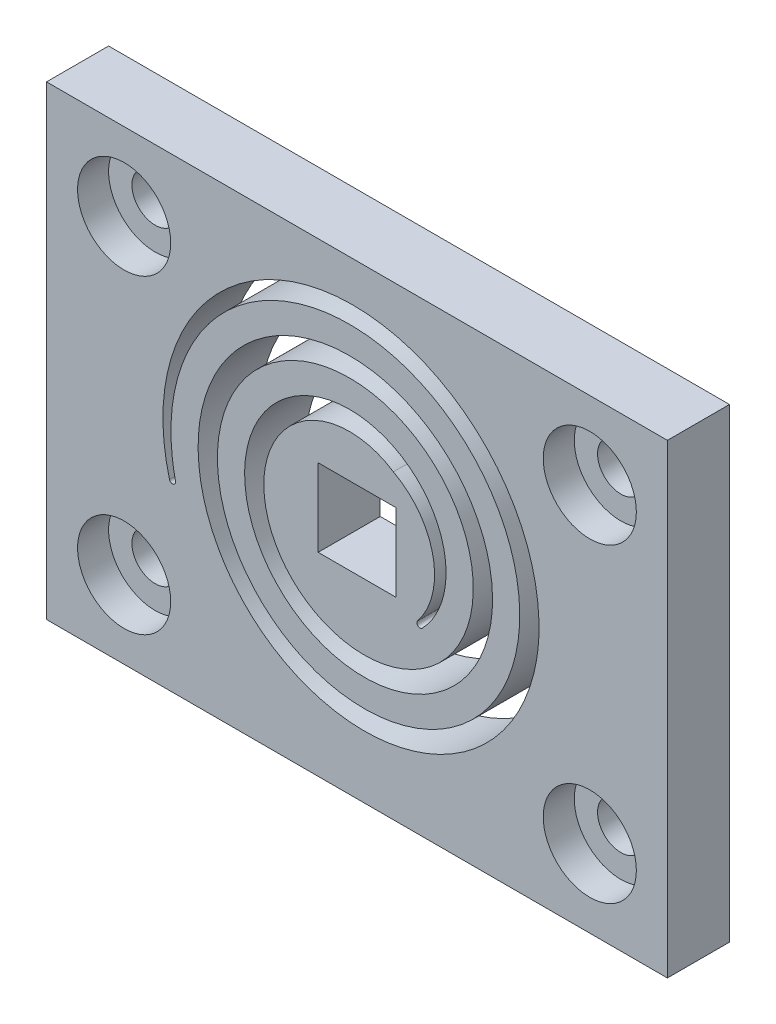
from build123d import *

# Parameters (mm, degrees)
SKIZZE1_W                       = 40
SKIZZE1_H                       = 30
AUFSATZ_LINEAR_AUSTRAGEN1_DEPTH = 4
SCHNITT_LINEAR_AUSTRAGEN3_REACH = 52.16
SKIZZE5_R                       = 12.5
SKIZZE5_R_2                     = 5
SKIZZE8_R                       = 3
SKIZZE8_R_2                     = 1.5
SCHNITT_LINEAR_AUSTRAGEN6_DEPTH = 2
SKIZZE8_3_R                     = 1.5
SCHNITT_LINEAR_AUSTRAGEN7_DEPTH = 4
AUSTRAGUNG3_DEPTH               = 4
VERRUNDUNG2_R                   = 0.2
SCHNITT_LINEAR_AUSTRAGEN8_REACH = 52.16
SKIZZE17_W                      = 5
SKIZZE17_H                      = 5
VERRUNDUNG3_DEPTH               = 4


with BuildPart() as part:
    # Skizze1 → Aufsatz-Linear austragen1 (new body)
    with BuildSketch(Plane.XY):
        with Locations((20, 15)):
            Rectangle(SKIZZE1_W, SKIZZE1_H)
    extrude(amount=AUFSATZ_LINEAR_AUSTRAGEN1_DEPTH)

    # Skizze5 → Schnitt-Linear austragen3 (cut, up to next)
    with BuildSketch(Plane.XY.offset(4), mode=Mode.PRIVATE) as schnitt_linear_austragen3_sk1:
        with Locations((20, 15)):
            Circle(SKIZZE5_R)
        with Locations((20, 15)):
            Circle(SKIZZE5_R_2, mode=Mode.SUBTRACT)
    schnitt_linear_austragen3_tool1 = extrude(schnitt_linear_austragen3_sk1.sketch, amount=-SCHNITT_LINEAR_AUSTRAGEN3_REACH, mode=Mode.PRIVATE) & part.part
    add(schnitt_linear_austragen3_tool1.solids().sort_by_distance((7.853553, 15, 4))[0], mode=Mode.SUBTRACT)


with BuildPart() as schnitt_linear_austragen3_piece_1:
    # of the separate pieces the step leaves, piece 1, a body of its own (schnitt_linear_austragen3_pieces)
    add(part.part.solids().sort_by_distance((0, 0, 0))[0])

    # Skizze8 → Schnitt-Linear austragen6 (cut)
    # profile 1 of 4: a face of its own
    with BuildSketch(Plane.XY.offset(4)):
        with Locations((5, 25)):
            Circle(SKIZZE8_R)
        with Locations((5, 25)):
            Circle(SKIZZE8_R_2, mode=Mode.SUBTRACT)
    # profile 2 of 4: a face of its own
    with BuildSketch(Plane.XY.offset(4)):
        with Locations((5, 5)):
            Circle(SKIZZE8_R)
        with Locations((5, 5)):
            Circle(SKIZZE8_R_2, mode=Mode.SUBTRACT)
    # profile 3 of 4: a face of its own
    with BuildSketch(Plane.XY.offset(4)):
        with Locations((35, 5)):
            Circle(SKIZZE8_R)
        with Locations((35, 5)):
            Circle(SKIZZE8_R_2, mode=Mode.SUBTRACT)
    # profile 4 of 4: a face of its own
    with BuildSketch(Plane.XY.offset(4)):
        with Locations((35, 25)):
            Circle(SKIZZE8_R)
        with Locations((35, 25)):
            Circle(SKIZZE8_R_2, mode=Mode.SUBTRACT)
    extrude(amount=-SCHNITT_LINEAR_AUSTRAGEN6_DEPTH, mode=Mode.SUBTRACT)

    # Skizze8<3> → Schnitt-Linear austragen7 (cut)
    with BuildSketch(Plane.XY.offset(4)):
        with Locations((5, 25)):
            Circle(SKIZZE8_3_R)
        with Locations((5, 5)):
            Circle(SKIZZE8_3_R)
        with Locations((35, 5)):
            Circle(SKIZZE8_3_R)
        with Locations((35, 25)):
            Circle(SKIZZE8_3_R)
    extrude(amount=-SCHNITT_LINEAR_AUSTRAGEN7_DEPTH, mode=Mode.SUBTRACT)



with BuildPart() as schnitt_linear_austragen3_piece_2:
    # of the separate pieces the step leaves, piece 2, a body of its own (schnitt_linear_austragen3_pieces)
    add(part.part.solids().sort_by_distance((25, 15, 0))[0])


with BuildPart() as schnitt_linear_austragen3_piece_1_1:
    add(schnitt_linear_austragen3_piece_1.part)

    add(schnitt_linear_austragen3_piece_2.part)  # Austragung3 merges Schnitt-Linear austragen3 piece 2
    # Austragung3: read off the stored shape, not the designer's step
    # Austragung3 outline → Austragung3 (add)
    with BuildSketch(Plane.XY):
        with BuildLine():
            ThreePointArc((20.290475643, 10.008444741), (15.115655057, 16.069193376), (22.349306116, 19.413701482))
            add(Edge.make_bspline(
                [(22.349306116, 19.413701482), (22.216520244, 19.501407181), (21.830098608, 19.730975714), (21.410473966, 19.909685311), (20.849463367, 20.09234631), (20.26798133, 20.22741462), (19.662909626, 20.261338126), (19.054675024, 20.242012194), (18.443396861, 20.16938524), (17.844897507, 19.990546946), (17.262077074, 19.759067332), (16.695069225, 19.474939888), (16.17775592, 19.092561984), (15.694099647, 18.664785764), (15.244231517, 18.191653197), (14.876884319, 17.640979395), (14.55799013, 17.058236973), (14.287660114, 16.443513543), (14.124228248, 15.782792022), (14.018828569, 15.108068598), (13.971536651, 14.41946753), (14.043557931, 13.723859806), (14.176496085, 13.035035891), (14.370379354, 12.353142455), (14.681850271, 11.70618519), (15.049721945, 11.0870547), (15.473969144, 10.495902206), (15.999433405, 9.979489855), (16.569572202, 9.509590232), (17.184307346, 9.086339803), (17.870554961, 8.770427378), (18.583645659, 8.514913194), (19.323455692, 8.319900657), (20.094783417, 8.253213859), (20.870938607, 8.254053472), (21.651765577, 8.322474955), (22.418296428, 8.525442788), (23.165986915, 8.795105072), (23.894667759, 9.131459914), (24.562819682, 9.592355628), (25.189663105, 10.11088872), (25.775036065, 10.686997461), (26.258921149, 11.361910526), (26.683057999, 12.077924883), (27.047312871, 12.83492402), (27.279681586, 13.651729834), (27.440342123, 14.487328381), (27.529207166, 15.341560607), (27.470553265, 16.207560016), (27.336464087, 17.066765156), (27.126911853, 17.918992596), (26.771528764, 18.731421048), (26.346024578, 19.511193166), (25.850437167, 20.25812316), (25.228550181, 20.91633968), (24.550623338, 21.518923067), (23.816758239, 22.065708396), (22.992312182, 22.483619442), (22.13330921, 22.828737762), (21.239904636, 23.100940842), (20.304111254, 23.218130172), (19.360315889, 23.253516566), (18.408710391, 23.207036992), (17.469990119, 22.997176352), (16.551851761, 22.706073685), (15.654501276, 22.333735739), (14.825924299, 21.809135934), (14.045134263, 21.213728235), (13.312326169, 20.547591137), (12.698007105, 19.759189492), (12.153934536, 18.919391522), (11.680267853, 18.028340548), (11.362349452, 17.060959576), (11.129481509, 16.068544446), (10.98176666, 15.051288056), (11.009612595, 14.014577756), (11.127577108, 12.983196773), (11.335691213, 11.9573656), (11.71869185, 10.973387825), (12.186176946, 10.025561643), (12.738099372, 9.114108939), (13.443097709, 8.30296798), (14.216548249, 7.555537221), (15.058328653, 6.872012613), (16.01213976, 6.337223285), (17.009553157, 5.886985692), (18.05038363, 5.521444777), (19.147271612, 5.336817384), (20.256800736, 5.248112602), (21.378743449, 5.255404718), (22.492107947, 5.455098355), (23.584580427, 5.750919966), (24.65591746, 6.142861575), (25.652902441, 6.715922437), (26.596857924, 7.373755824), (27.487553909, 8.116269631), (28.244893433, 9.006464309), (28.922388468, 9.959509097), (29.519851075, 10.975236177), (29.939063026, 12.086368531), (30.260345096, 13.230167389), (30.483575815, 14.40640722), (30.503635746, 15.61264428), (30.418867949, 16.816481009), (30.229234458, 18.017659815), (29.835109036, 19.177768545), (29.341635485, 20.299596184), (28.748866697, 21.382883482), (27.974698591, 22.35678897), (26.976263877, 23.410485695), (26.011805531, 24.219032699), (24.920281868, 24.852809125), (24.168641042, 25.232873155), (23.005384359, 25.739175111), (21.75861341, 26.044172507), (20.062968032, 26.255827089), (18.766620939, 26.268192643), (17.483890826, 26.058474697), (16.637513209, 25.869243945), (15.381298092, 25.511273312), (14.190493322, 24.938710537), (12.703971152, 23.998632227), (11.66534831, 23.161214095), (10.782846676, 22.156388763), (10.233811014, 21.453012649), (9.469351813, 20.347836157), (8.897168603, 19.115082967), (8.330114229, 17.397397156), (8.051907523, 16.053963886), (8.007000895, 14.679770552), (8.030133771, 13.762756925), (8.144471456, 12.386105677), (8.494710249, 11.033885094), (9.165390571, 9.300187284), (9.821098849, 8.052257993), (10.681874929, 6.932318309), (11.298380987, 6.219649623), (12.287019732, 5.201759852), (13.446734199, 4.3572557), (14.289046308, 3.881953979), (14.3001077, 3.875734642), (14.311179272, 3.869531963)],
                knots=[0.190993157, 0.190993157, 0.190993157, 0.190993157, 0.1953125, 0.203125, 0.203125, 0.2109375, 0.21875, 0.21875, 0.2265625, 0.234375, 0.234375, 0.2421875, 0.25, 0.25, 0.2578125, 0.265625, 0.265625, 0.2734375, 0.28125, 0.28125, 0.2890625, 0.296875, 0.296875, 0.3046875, 0.3125, 0.3125, 0.3203125, 0.328125, 0.328125, 0.3359375, 0.34375, 0.34375, 0.3515625, 0.359375, 0.359375, 0.3671875, 0.375, 0.375, 0.3828125, 0.390625, 0.390625, 0.3984375, 0.40625, 0.40625, 0.4140625, 0.421875, 0.421875, 0.4296875, 0.4375, 0.4375, 0.4453125, 0.453125, 0.453125, 0.4609375, 0.46875, 0.46875, 0.4765625, 0.484375, 0.484375, 0.4921875, 0.5, 0.5, 0.5078125, 0.515625, 0.515625, 0.5234375, 0.53125, 0.53125, 0.5390625, 0.546875, 0.546875, 0.5546875, 0.5625, 0.5625, 0.5703125, 0.578125, 0.578125, 0.5859375, 0.59375, 0.59375, 0.6015625, 0.609375, 0.609375, 0.6171875, 0.625, 0.625, 0.6328125, 0.640625, 0.640625, 0.6484375, 0.65625, 0.65625, 0.6640625, 0.671875, 0.671875, 0.6796875, 0.6875, 0.6875, 0.6953125, 0.703125, 0.703125, 0.7109375, 0.71875, 0.71875, 0.7265625, 0.734375, 0.734375, 0.7421875, 0.75, 0.75, 0.760416667, 0.765625, 0.765625, 0.770833333, 0.78125, 0.78125, 0.791666667, 0.796875, 0.796875, 0.802083333, 0.8125, 0.8125, 0.822916667, 0.828125, 0.828125, 0.833333333, 0.84375, 0.84375, 0.854166667, 0.859375, 0.859375, 0.864583333, 0.875, 0.875, 0.885416667, 0.890625, 0.890625, 0.895833333, 0.90625, 0.90625, 0.906388484, 0.906388484, 0.906388484, 0.906388484], degree=3))
            ThreePointArc((14.311179272, 3.869531963), (26.524559023, 4.337911577), (32.5, 15))
            Line((32.5, 15), (31.715343371, 14.844070609))
            add(Edge.make_bspline(
                [(20.290475643, 10.008444741), (20.522546626, 9.999892259), (21.047217951, 10.017189894), (21.570988673, 10.116930877), (22.141443019, 10.278705827), (22.702247122, 10.4918175), (23.226260666, 10.802466151), (23.722965271, 11.159483808), (24.192198974, 11.562808744), (24.591407323, 12.047584206), (24.947845877, 12.567604821), (25.261380888, 13.12275408), (25.478489026, 13.732041051), (25.641837036, 14.360360426), (25.751337602, 15.007553151), (25.748583895, 15.673181635), (25.687192817, 16.338314747), (25.567136589, 17.002769058), (25.332158832, 17.64562751), (25.040727335, 18.267436942), (24.69287997, 18.868011563), (24.241646684, 19.407449387), (23.743302151, 19.90679465), (23.197947977, 20.365882429), (22.574238314, 20.729784207), (21.919114176, 21.038530668), (21.232730874, 21.291999295), (20.504066436, 21.426277113), (19.764391849, 21.496405497), (19.013898961, 21.502321418), (18.264280433, 21.378591071), (17.52644532, 21.189208464), (16.800599579, 20.934180345), (16.1208238, 20.554565526), (15.475287567, 20.11583457), (14.86418588, 19.618065969), (14.340859557, 19.01639484), (13.871082527, 18.369747772), (13.455014181, 17.678268086), (13.159592334, 16.917353302), (12.931341854, 16.131801771), (12.770365379, 15.321806392), (12.749594111, 14.486982173), (12.801985335, 13.651819389), (12.927570065, 12.816538534), (13.196591966, 12.00610749), (13.536059517, 11.220765918), (13.945925591, 10.460735702), (14.485021158, 9.774392937), (15.083096799, 9.136608722), (15.740030174, 8.547579008), (16.49555037, 8.074176779), (17.290878494, 7.66786945), (18.125829333, 7.328801965), (19.015370813, 7.134953352), (19.919879652, 7.019319156), (20.839128297, 6.981973662), (21.760474532, 7.102945735), (22.66909872, 7.304167988), (23.564757431, 7.585632447), (24.407621313, 8.019748015), (25.210506161, 8.526453873), (25.973181974, 9.105657913), (26.632401235, 9.813032985), (27.228171002, 10.576201182), (27.760303336, 11.394994685), (28.14891067, 12.300929844), (28.457399757, 13.238426531), (28.685649126, 14.207259214), (28.746198347, 15.210037049), (28.719053771, 16.215389312), (28.604177433, 17.223058409), (28.316868583, 18.205343665), (27.944636495, 19.159823396), (27.487534059, 20.086238351), (26.874060352, 20.928789847), (26.074483682, 21.846570497), (25.293482227, 22.558424007), (24.399468821, 23.128485955), (23.781501149, 23.473706267), (22.821753671, 23.939191547), (21.782435405, 24.239086662), (20.360591528, 24.475292653), (19.267494003, 24.5295876), (18.177728097, 24.396196703), (17.456672772, 24.265013562), (16.383460323, 24.004858715), (15.356058966, 23.560180278), (14.065312995, 22.813037187), (13.15695104, 22.137137543), (12.37492101, 21.313848071), (11.885752853, 20.734915582), (11.200424561, 19.821534105), (10.67313946, 18.791336027), (10.134648024, 17.346996476), (9.854387618, 16.211027483), (9.771714012, 15.0408275), (9.762004822, 14.25793053), (9.815583286, 13.079635901), (10.071799406, 11.912332671), (10.590871766, 10.407834187), (11.113190775, 9.318786534), (11.815209977, 8.33236304), (12.321154458, 7.702386199), (13.136865351, 6.799055771), (14.106506652, 6.037605864), (15.506360135, 5.180141801), (16.636180349, 4.655661262), (17.84149058, 4.330728671), (18.657037104, 4.160969394), (19.898168797, 3.976695954), (21.16851213, 4.006189152), (22.843790903, 4.241068266), (24.085939484, 4.563894642), (25.257229058, 5.094742868), (26.016893314, 5.493728966), (27.12439321, 6.159766173), (28.114872743, 7.014683077), (29.292940299, 8.297747382), (30.069224689, 9.367148277), (30.651875836, 10.555026122), (30.994299301, 11.368916828), (31.438805671, 12.622520358), (31.670943161, 13.950254429), (31.715343371, 14.844070609)],
                knots=[0.360888223, 0.360888223, 0.360888223, 0.360888223, 0.3671875, 0.375, 0.375, 0.3828125, 0.390625, 0.390625, 0.3984375, 0.40625, 0.40625, 0.4140625, 0.421875, 0.421875, 0.4296875, 0.4375, 0.4375, 0.4453125, 0.453125, 0.453125, 0.4609375, 0.46875, 0.46875, 0.4765625, 0.484375, 0.484375, 0.4921875, 0.5, 0.5, 0.5078125, 0.515625, 0.515625, 0.5234375, 0.53125, 0.53125, 0.5390625, 0.546875, 0.546875, 0.5546875, 0.5625, 0.5625, 0.5703125, 0.578125, 0.578125, 0.5859375, 0.59375, 0.59375, 0.6015625, 0.609375, 0.609375, 0.6171875, 0.625, 0.625, 0.6328125, 0.640625, 0.640625, 0.6484375, 0.65625, 0.65625, 0.6640625, 0.671875, 0.671875, 0.6796875, 0.6875, 0.6875, 0.6953125, 0.703125, 0.703125, 0.7109375, 0.71875, 0.71875, 0.7265625, 0.734375, 0.734375, 0.7421875, 0.75, 0.75, 0.760416667, 0.765625, 0.765625, 0.770833333, 0.78125, 0.78125, 0.791666667, 0.796875, 0.796875, 0.802083333, 0.8125, 0.8125, 0.822916667, 0.828125, 0.828125, 0.833333333, 0.84375, 0.84375, 0.854166667, 0.859375, 0.859375, 0.864583333, 0.875, 0.875, 0.885416667, 0.890625, 0.890625, 0.895833333, 0.90625, 0.90625, 0.916666667, 0.921875, 0.921875, 0.927083333, 0.9375, 0.9375, 0.947916667, 0.953125, 0.953125, 0.958333333, 0.96875, 0.96875, 0.979166667, 0.984375, 0.984375, 0.989583333, 1, 1, 1, 1], degree=3))
        make_face()
    extrude(amount=AUSTRAGUNG3_DEPTH)

    # Verrundung2
    verrundung2_edges = [schnitt_linear_austragen3_piece_1_1.edges().sort_by_distance(p)[0] for p in [
        (20.290475643, 10.008444741, 2),
        (14.311179272, 3.869531963, 2),
    ]]
    fillet(verrundung2_edges, radius=VERRUNDUNG2_R)

    # Skizze17 → Schnitt-Linear austragen8 (cut, up to next)
    with BuildSketch(Plane.XY.offset(4), mode=Mode.PRIVATE) as schnitt_linear_austragen8_sk1:
        with Locations((20, 15)):
            Rectangle(SKIZZE17_W, SKIZZE17_H)
    schnitt_linear_austragen8_tool1 = extrude(schnitt_linear_austragen8_sk1.sketch, amount=-SCHNITT_LINEAR_AUSTRAGEN8_REACH, mode=Mode.PRIVATE) & schnitt_linear_austragen3_piece_1_1.part
    add(schnitt_linear_austragen8_tool1.solids().sort_by_distance((20, 15, 4))[0], mode=Mode.SUBTRACT)

    # Verrundung3: read off the stored shape, not the designer's step
    # Verrundung3 outline → Verrundung3 (add)
    with BuildSketch(Plane.XY):
        with BuildLine():
            ThreePointArc((13.229670854, 25.507742062), (25.725375487, 25.814814078), (31.715343371, 14.844070609))
            Line((31.715343371, 14.844070609), (32.5, 15))
            ThreePointArc((32.5, 15), (25.984182721, 25.974495759), (13.229670854, 25.507742062))
        make_face()
    extrude(amount=VERRUNDUNG3_DEPTH)


solid = schnitt_linear_austragen3_piece_1_1.part
